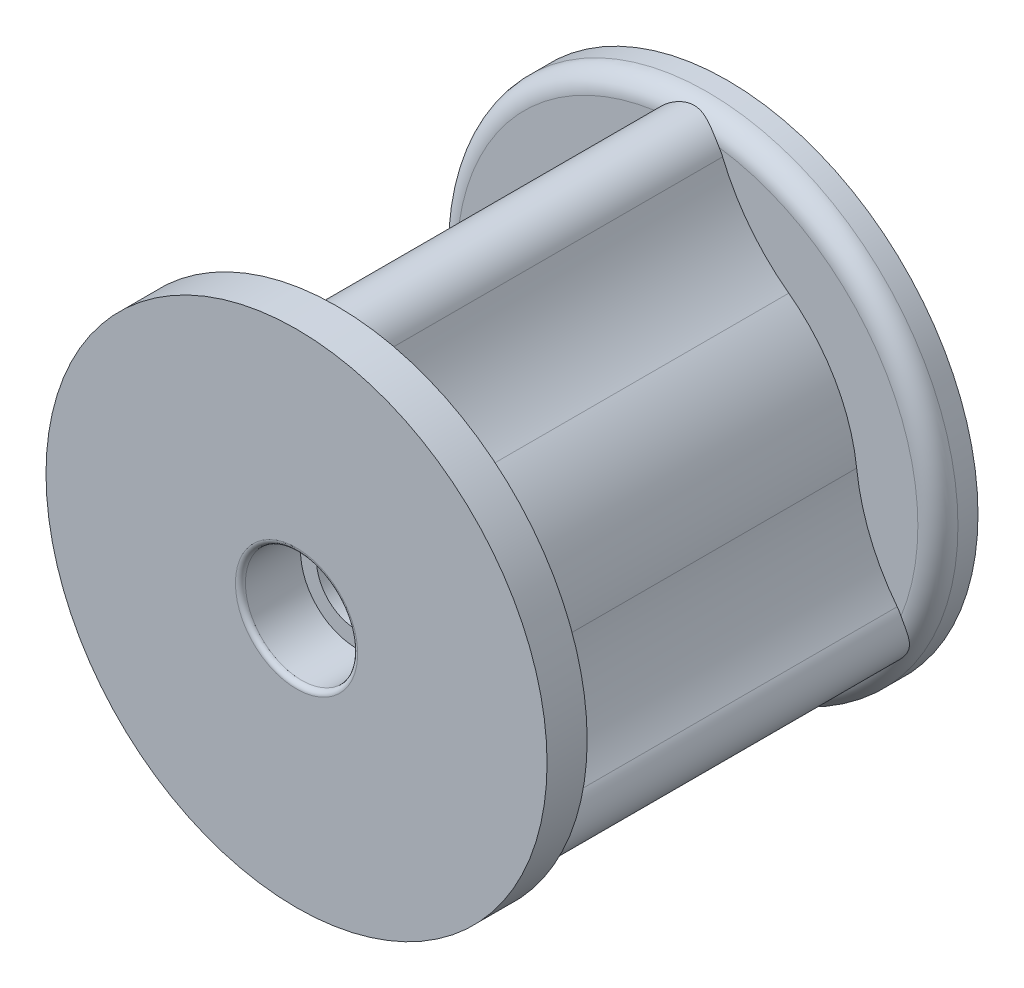
from build123d import *

# Parameters (mm, degrees)
SKETCH1_R           = 12.5
BOSS_EXTRUDE1_DEPTH = 2
SKETCH2_R           = 1.9
BOSS_EXTRUDE2_DEPTH = 17.5
SKETCH3_R           = 8.5
BOSS_EXTRUDE3_DEPTH = 8.75
SKETCH4_R           = 2
CUT_EXTRUDE1_DEPTH  = 28.834331319
SKETCH5_R           = 5.35
CUT_EXTRUDE2_DEPTH  = 11.5
FILLET1_R           = 0.5
SKETCH6_R           = 2.8
CUT_EXTRUDE3_DEPTH  = 3
FILLET2_R           = 0.25
FILLET3_R           = 10
FILLET4_R           = 10
FILLET5_R           = 10
FILLET6_R           = 10
FILLET7_R           = 10
FILLET8_R           = 10
FILLET9_R           = 1
FILLET10_R          = 0.4


with BuildPart() as part:
    # Sketch1 → Boss-Extrude1 (new body)
    with BuildSketch(Plane(origin=(0, 0, 0), x_dir=(0, 1, 0), z_dir=(0, 0, 1))):
        with Locations(Location((0, 0, 0), (0, 0, 270))):
            Circle(SKETCH1_R)
    boss_extrude1 = extrude(amount=BOSS_EXTRUDE1_DEPTH)

    # Sketch2 → Boss-Extrude2 (add)
    with BuildSketch(Plane.XY.offset(2)):
        with Locations((0, 10.35)):
            Circle(SKETCH2_R)
        with Locations((8.963362929, -5.175)):
            Circle(SKETCH2_R)
        with Locations((-8.963362929, -5.175)):
            Circle(SKETCH2_R)
    extrude(amount=BOSS_EXTRUDE2_DEPTH)

    # Sketch3 → Boss-Extrude3 (add)
    with BuildSketch(Plane.XY.offset(2)):
        Circle(SKETCH3_R)
    boss_extrude3 = extrude(amount=BOSS_EXTRUDE3_DEPTH)

    # Mirror2: Boss-Extrude1, Boss-Extrude3 across plane
    add(boss_extrude1.mirror(Plane.XY.offset(10.75)))
    add(boss_extrude3.mirror(Plane.XY.offset(10.75)))

    # Sketch4 → Cut-Extrude1 (cut, through all)
    with BuildSketch(Plane.XY.offset(21.5)):
        Circle(SKETCH4_R)
    extrude(amount=-CUT_EXTRUDE1_DEPTH, mode=Mode.SUBTRACT)

    # Sketch5 → Cut-Extrude2 (cut)
    with BuildSketch(Plane(origin=(0, 0, 0), x_dir=(1, 0, 0), z_dir=(0, 0, -1))):
        with Locations(Location((0, 0, 0), (0, 0, 180))):
            Circle(SKETCH5_R)
    extrude(amount=-CUT_EXTRUDE2_DEPTH, mode=Mode.SUBTRACT)

    # Fillet1
    fillet1_edges = [part.edges().sort_by_distance(p)[0] for p in [
        (5.35, 0, 0),
    ]]
    fillet(fillet1_edges, radius=FILLET1_R)

    # Sketch6 → Cut-Extrude3 (cut)
    with BuildSketch(Plane.XY.offset(21.5)):
        Circle(SKETCH6_R)
    extrude(amount=-CUT_EXTRUDE3_DEPTH, mode=Mode.SUBTRACT)

    # Fillet2
    fillet2_edges = [part.edges().sort_by_distance(p)[0] for p in [
        (-2.8, 0, 21.5),
    ]]
    fillet(fillet2_edges, radius=FILLET2_R)

    # Fillet3
    fillet3_edges = [part.edges().sort_by_distance(p)[0] for p in [
        (-7.549524157, -3.905724645, 10.75),
    ]]
    fillet(fillet3_edges, radius=FILLET3_R)

    # Fillet4
    fillet4_edges = [part.edges().sort_by_distance(p)[0] for p in [
        (-7.157218842, -4.585217384, 10.75),
    ]]
    fillet(fillet4_edges, radius=FILLET4_R)

    # Fillet5
    fillet5_edges = [part.edges().sort_by_distance(p)[0] for p in [
        (0.392305315, 8.490942029, 10.75),
    ]]
    fillet(fillet5_edges, radius=FILLET5_R)

    # Fillet6
    fillet6_edges = [part.edges().sort_by_distance(p)[0] for p in [
        (-0.392305315, 8.490942029, 10.75),
    ]]
    fillet(fillet6_edges, radius=FILLET6_R)

    # Fillet7
    fillet7_edges = [part.edges().sort_by_distance(p)[0] for p in [
        (7.549524157, -3.905724645, 10.75),
    ]]
    fillet(fillet7_edges, radius=FILLET7_R)

    # Fillet8
    fillet8_edges = [part.edges().sort_by_distance(p)[0] for p in [
        (7.157218842, -4.585217384, 10.75),
    ]]
    fillet(fillet8_edges, radius=FILLET8_R)

    # Fillet9
    # the kernel refuses this fillet: 1 mm, written as the material it takes off along each edge
    with BuildSketch(Plane(origin=(0, 0, 2), x_dir=(1, 0, 0), z_dir=(0, -1, 0))) as fillet9_piece_1_section:
        with BuildLine():
            CenterArc((12.5 - FILLET9_R, -FILLET9_R), FILLET9_R, 0, 90)
            Line((12.5, -FILLET9_R), (12.5, 0))
            Line((12.5, 0), (12.5 - FILLET9_R, 0))
        make_face()
    fillet9_piece_1 = revolve(axis=Axis((0, 0, 2), (0, 0, 1)), mode=Mode.PRIVATE)
    fillet9_piece_1 = fillet9_piece_1 - Plane(origin=(8.963362929, -5.175, 1.726039761), x_dir=(1, 0, 0), z_dir=(0, 0, -1)) * Cylinder(1.9, 51, mode=Mode.PRIVATE)
    fillet9_piece_1 = fillet9_piece_1 - Plane(origin=(-8.963362929, -5.175, 1.726039761), x_dir=(1, 0, 0), z_dir=(0, 0, -1)) * Cylinder(1.9, 51, mode=Mode.PRIVATE)
    fillet9_piece_1 = fillet9_piece_1 - Plane(origin=(0, 10.35, 1.726039761), x_dir=(1, 0, 0), z_dir=(0, 0, -1)) * Cylinder(1.9, 51, mode=Mode.PRIVATE)
    add(fillet9_piece_1, mode=Mode.SUBTRACT)

    # Fillet10
    fillet10_edges = [part.edges().sort_by_distance(p)[0] for p in [
        (5.35, 0, 11.5),
    ]]
    fillet(fillet10_edges, radius=FILLET10_R)


solid = part.part
